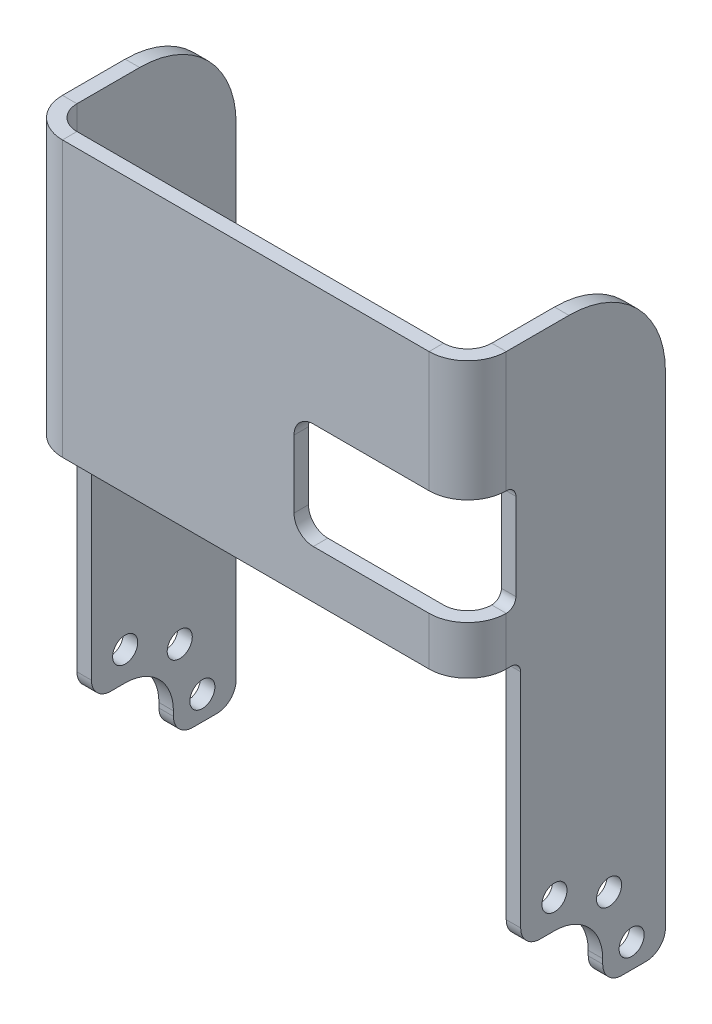
from build123d import *

# Parameters (mm, degrees)
BASE_FLANGE1_DEPTH      = 62
CUT_EXTRUDE4_START      = -23
CUT_EXTRUDE4_OUTLINE_R  = 1.3
CUT_EXTRUDE4_DEPTH      = 46
CUT_EXTRUDE5_DEPTH      = 69.804069647
CUT_EXTRUDE5_DEPTH_BACK = 69.804069647
SKETCH9_W               = 9
SKETCH9_H               = 7.5
CUT_EXTRUDE7_DEPTH      = 69.804069647
CUT_EXTRUDE7_DEPTH_BACK = 69.804069647
SKETCH12_W              = 5.5
SKETCH12_H              = 26
SKETCH14_W              = 5
SKETCH14_H              = 11
CUT_EXTRUDE8_DEPTH      = 18
FILLET1_R               = 10
FILLET2_R               = 2
FILLET3_R               = 1


# Read off the part's stored shape, not the designer's step: Cut-Extrude4
# Sheet-metal steps are written as plain solids
with BuildPart() as part:
    # Sketch2 → Base-Flange1 (new body)
    with BuildSketch(Plane(origin=(0, 0, 0), x_dir=(1, 0, 0), z_dir=(0, 1, 0))):
        with BuildLine():
            Line((-21.5, 19), (-21.5, 2.5))
            ThreePointArc((-21.5, 2.5), (-20.767766953, 0.732233047), (-19, 0))
            Line((-19, 0), (19, 0))
            ThreePointArc((19, 0), (20.767766953, 0.732233047), (21.5, 2.5))
            Line((21.5, 2.5), (21.5, 19))
            Line((21.5, 19), (23, 19))
            Line((23, 19), (23, 2.5))
            ThreePointArc((23, 2.5), (21.828427125, -0.328427125), (19, -1.5))
            Line((19, -1.5), (-19, -1.5))
            ThreePointArc((-19, -1.5), (-21.828427125, -0.328427125), (-23, 2.5))
            Line((-23, 2.5), (-23, 19))
            Line((-23, 19), (-21.5, 19))
        make_face()
    extrude(amount=BASE_FLANGE1_DEPTH)

    # Cut-Extrude4 outline → Cut-Extrude4 (cut)
    with BuildSketch(Plane(origin=(0, 0, 0), x_dir=(0, 0, -1), z_dir=(1, 0, 0)).offset(CUT_EXTRUDE4_START)):
        with Locations((15.5, 2.5)):
            Circle(CUT_EXTRUDE4_OUTLINE_R)
        with Locations((13.156854249, 8.156854249)):
            Circle(CUT_EXTRUDE4_OUTLINE_R)
        with Locations((7.5, 10.5)):
            Circle(CUT_EXTRUDE4_OUTLINE_R)
        with BuildLine():
            ThreePointArc((12.5, 2.5), (7.5, 7.5), (2.5, 2.5))
            Line((2.5, 2.5), (2.5, 0))
            Line((2.5, 0), (12.5, 0))
            Line((12.5, 0), (12.5, 2.5))
        make_face()
    extrude(amount=CUT_EXTRUDE4_DEPTH, mode=Mode.SUBTRACT)

    # Sketch9 → Cut-Extrude5 (cut, two sides: drawn at the far end of the back side and taken through both)
    with BuildSketch(Plane(origin=(0, 0, 0), x_dir=(0, 0, -1), z_dir=(1, 0, 0)).offset(-CUT_EXTRUDE5_DEPTH_BACK)):
        with Locations((3, 3.75)):
            Rectangle(SKETCH9_W, SKETCH9_H)
    extrude(amount=CUT_EXTRUDE5_DEPTH + CUT_EXTRUDE5_DEPTH_BACK, mode=Mode.SUBTRACT)

    # Sketch12 → Cut-Extrude7 (cut, two sides: drawn at the far end of the back side and taken through both)
    with BuildSketch(Plane(origin=(0, 0, 0), x_dir=(0, 0, -1), z_dir=(1, 0, 0)).offset(-CUT_EXTRUDE7_DEPTH_BACK)):
        with Locations((1.25, 20.5)):
            Rectangle(SKETCH12_W, SKETCH12_H)
    extrude(amount=CUT_EXTRUDE7_DEPTH + CUT_EXTRUDE7_DEPTH_BACK, mode=Mode.SUBTRACT)

    # Sketch14 → Cut-Extrude8 (cut)
    with BuildSketch(Plane(origin=(23, 0, 0), x_dir=(0, 0, -1), z_dir=(1, 0, 0))):
        with Locations((1, 44)):
            Rectangle(SKETCH14_W, SKETCH14_H)
    extrude(amount=-CUT_EXTRUDE8_DEPTH, mode=Mode.SUBTRACT)

    # Fillet1
    fillet1_edges = [part.edges().sort_by_distance(p)[0] for p in [
        (-22.25, 62, -19),
        (22.25, 62, -19),
    ]]
    fillet(fillet1_edges, radius=FILLET1_R)

    # Fillet2
    fillet2_edges = [part.edges().sort_by_distance(p)[0] for p in [
        (-22.25, 0, -19),
        (22.25, 0, -19),
        (22.25, 7.5, -4),
        (-22.25, 7.5, -4),
        (5, 49.5, 0.75),
        (5, 38.5, 0.75),
        (-22.25, 0, -12.5),
        (22.25, 0, -12.5),
    ]]
    fillet(fillet2_edges, radius=FILLET2_R)

    # Fillet3
    fillet3_edges = [part.edges().sort_by_distance(p)[0] for p in [
        (22.25, 33.5, -4),
        (-22.25, 33.5, -4),
        (22.25, 49.5, -3.5),
        (22.25, 38.5, -3.5),
    ]]
    fillet(fillet3_edges, radius=FILLET3_R)


solid = part.part
